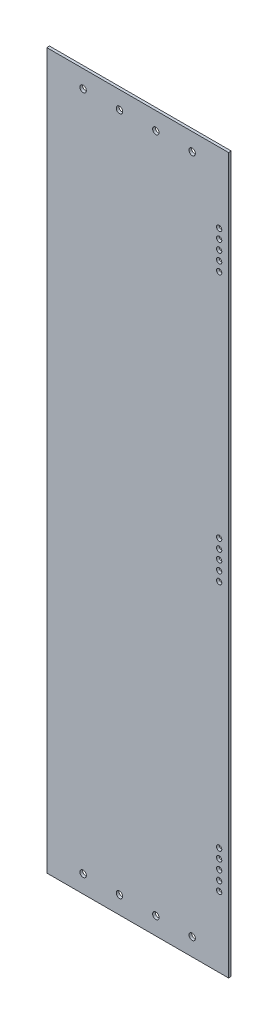
from build123d import *

# Parameters (mm, degrees)
SKETCH1_W            = 155
SKETCH1_H            = 609.6
BOSS_EXTRUDE1_DEPTH  = 2.305
M4_CLEARANCE_HOLE1_D = 4.5
M5_CLEARANCE_HOLE1_D = 5.5


with BuildPart() as part:
    # Sketch1 → Boss-Extrude1 (new body)
    with BuildSketch(Plane.XY):
        Rectangle(SKETCH1_W, SKETCH1_H)
    extrude(amount=BOSS_EXTRUDE1_DEPTH)

    # M4 Clearance Hole1 (through all)
    with Locations(Plane.XY.offset(2.305)):
        with Locations((69.5, 228.8), (69.5, 244.8), (69.5, 236.8), (69.5, 220.8), (69.5, 212.8), (69.5, 16), (69.5, 8), (69.5, 0), (69.5, -8), (69.5, -16), (69.5, -212.8), (69.5, -220.8), (69.5, -228.8), (69.5, -236.8), (69.5, -244.8)):
            Hole(M4_CLEARANCE_HOLE1_D / 2)

    # M5 Clearance Hole1 (through all)
    with Locations(Plane.XY.offset(2.305)):
        with Locations((-46.5, -289.795), (-15.5, -289.795), (15.5, -289.795), (46.5, -289.795), (-46.5, 289.795), (-15.5, 289.795), (15.5, 289.795), (46.5, 289.795)):
            Hole(M5_CLEARANCE_HOLE1_D / 2)


solid = part.part
